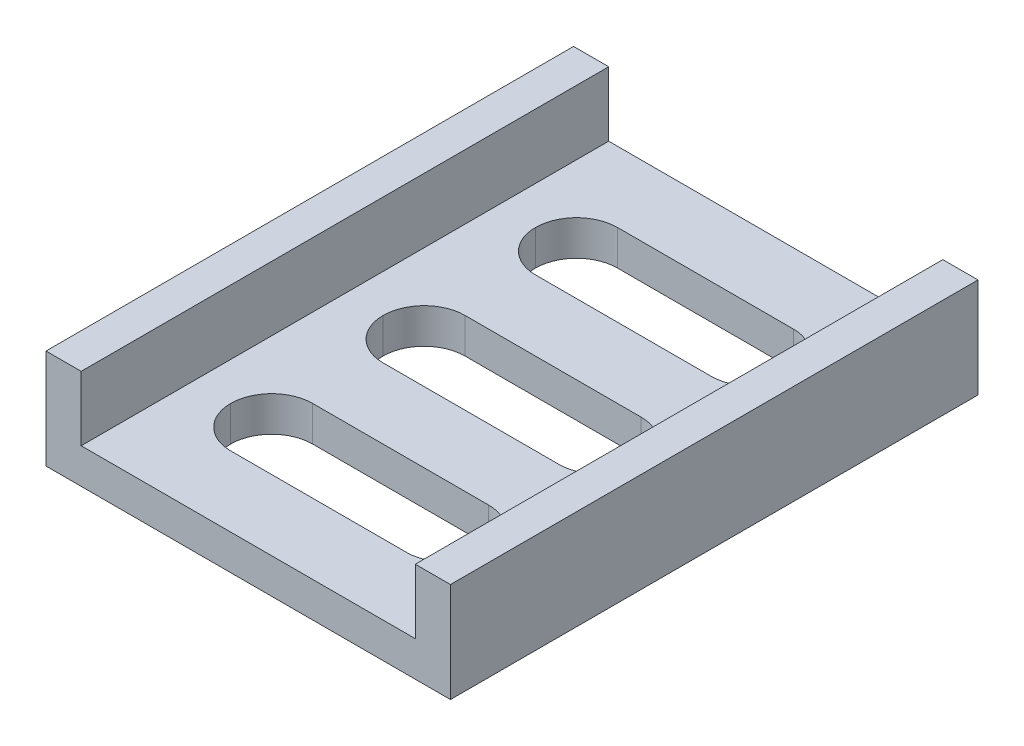
from build123d import *

# Parameters (mm, degrees)
SKETCH2_W           = 34.5
SKETCH2_H           = 45
BOSS_EXTRUDE1_DEPTH = 3
SKETCH3_W           = 3
SKETCH3_H           = 45
BOSS_EXTRUDE2_DEPTH = 5.5
SKETCH4_W           = 22
SKETCH4_H           = 7
CUT_EXTRUDE1_DEPTH  = 8
FILLET1_R           = 3.5


with BuildPart() as part:
    # Sketch2 → Boss-Extrude1 (new body)
    with BuildSketch(Plane(origin=(0, 0, 0), x_dir=(1, 0, 0), z_dir=(0, 1, 0))):
        Rectangle(SKETCH2_W, SKETCH2_H)
    extrude(amount=BOSS_EXTRUDE1_DEPTH)

    # Sketch3 → Boss-Extrude2 (add)
    with BuildSketch(Plane(origin=(0, 3, 0), x_dir=(1, 0, 0), z_dir=(0, 1, 0))):
        with Locations((-15.75, 0)):
            Rectangle(SKETCH3_W, SKETCH3_H)
        with Locations((15.75, 0)):
            Rectangle(SKETCH3_W, SKETCH3_H)
    extrude(amount=BOSS_EXTRUDE2_DEPTH)

    # Sketch4 → Cut-Extrude1 (cut)
    with BuildSketch(Plane.XZ):
        with Locations((0, 13)):
            Rectangle(SKETCH4_W, SKETCH4_H)
        Rectangle(SKETCH4_W, SKETCH4_H)
        with Locations((0, -13)):
            Rectangle(SKETCH4_W, SKETCH4_H)
    extrude(amount=-CUT_EXTRUDE1_DEPTH, mode=Mode.SUBTRACT)

    # Fillet1
    fillet1_edges = [part.edges().sort_by_distance(p)[0] for p in [
        (-11, 1.5, -9.5),
        (-11, 1.5, -16.5),
        (11, 1.5, -9.5),
        (11, 1.5, -16.5),
        (11, 1.5, -3.5),
        (-11, 1.5, -3.5),
        (-11, 1.5, 3.5),
        (11, 1.5, 3.5),
        (11, 1.5, 9.5),
        (11, 1.5, 16.5),
        (-11, 1.5, 9.5),
        (-11, 1.5, 16.5),
    ]]
    fillet(fillet1_edges, radius=FILLET1_R - 0.0001)  # a hair under: the kernel refuses the full size


solid = part.part
